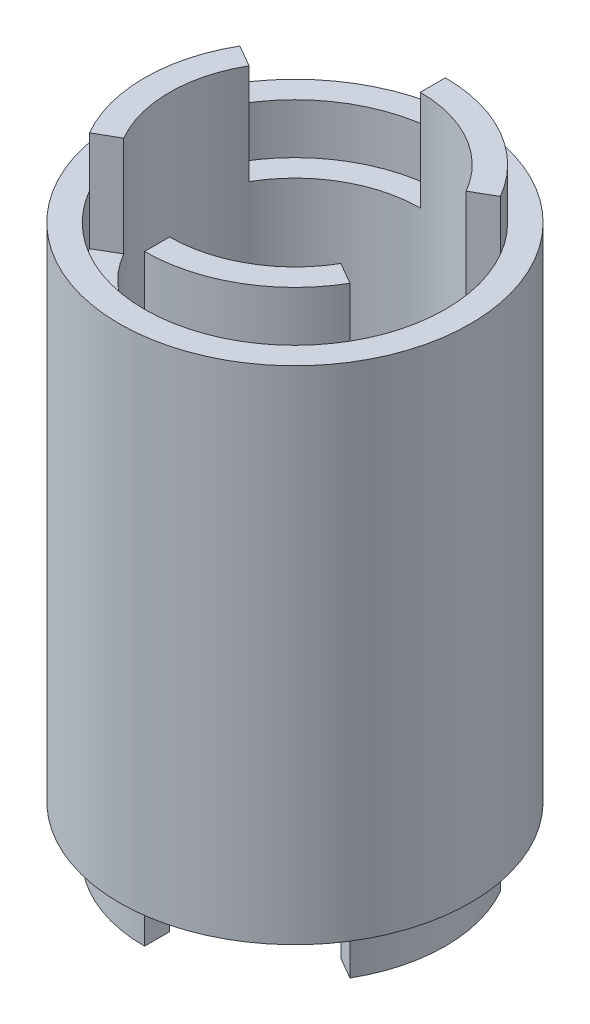
from build123d import *
from build123d.topology import SkipClean

# Parameters (mm, degrees)
SKETCH1_R           = 15
SKETCH1_R_2         = 12.5
BOSS_EXTRUDE1_DEPTH = 17.5
SKETCH2_R           = 17.5
SKETCH2_R_2         = 15
BOSS_EXTRUDE2_DEPTH = 25
BOSS_EXTRUDE3_START = 12.5
SKETCH3_R           = 15
SKETCH3_R_2         = 12.5
BOSS_EXTRUDE3_DEPTH = 12.5
BOSS_EXTRUDE4_DEPTH = 12.5
BOSS_EXTRUDE6_DEPTH = 2.5
CUT_EXTRUDE1_DEPTH  = 10


with BuildPart() as part:
    # Sketch1 → Boss-Extrude1 (new, symmetric)
    with BuildSketch(Plane(origin=(0, 0, 0), x_dir=(1, 0, 0), z_dir=(0, 1, 0))):
        Circle(SKETCH1_R)
        Circle(SKETCH1_R_2, mode=Mode.SUBTRACT)
    extrude(amount=BOSS_EXTRUDE1_DEPTH, both=True)

    # Sketch2 → Boss-Extrude2 (add, symmetric)
    with BuildSketch(Plane(origin=(0, 0, 0), x_dir=(1, 0, 0), z_dir=(0, 1, 0))):
        Circle(SKETCH2_R)
        Circle(SKETCH2_R_2, mode=Mode.SUBTRACT)
    extrude(amount=BOSS_EXTRUDE2_DEPTH, both=True)

    # Sketch3 → Boss-Extrude3 (add)
    with BuildSketch(Plane.XZ.offset(17.5).offset(BOSS_EXTRUDE3_START)):
        Circle(SKETCH3_R)
        Circle(SKETCH3_R_2, mode=Mode.SUBTRACT)
    extrude(amount=-BOSS_EXTRUDE3_DEPTH)

    # Sketch4 → Boss-Extrude4 (add)
    with SkipClean():  # the faces are left unmerged after this step: merging them gives an invalid solid
        with BuildSketch(Plane(origin=(0, 17.5, 0), x_dir=(1, 0, 0), z_dir=(0, 1, 0))):
            with BuildLine():
                Line((0, 12.5), (0, 15))
                ThreePointArc((0, 15), (7.5, 12.990381057), (12.990381057, 7.5))
                Line((12.990381057, 7.5), (10.825317547, 6.25))
                ThreePointArc((10.825317547, 6.25), (6.25, 10.825317547), (0, 12.5))
            make_face()
            with BuildLine():
                Line((10.825317547, -6.25), (12.990381057, -7.5))
                ThreePointArc((12.990381057, -7.5), (7.5, -12.990381057), (0, -15))
                Line((0, -15), (0, -12.5))
                ThreePointArc((0, -12.5), (6.25, -10.825317547), (10.825317547, -6.25))
            make_face()
            with BuildLine():
                Line((-10.825317547, -6.25), (-12.990381057, -7.5))
                ThreePointArc((-12.990381057, -7.5), (-15, 0), (-12.990381057, 7.5))
                Line((-12.990381057, 7.5), (-10.825317547, 6.25))
                ThreePointArc((-10.825317547, 6.25), (-12.5, 0), (-10.825317547, -6.25))
            make_face()
        extrude(amount=BOSS_EXTRUDE4_DEPTH)

    # Sketch6 → Boss-Extrude6 (add)
    with SkipClean():  # the faces are left unmerged after this step: merging them gives an invalid solid
        with BuildSketch(Plane(origin=(0, 17.5, 0), x_dir=(1, 0, 0), z_dir=(0, 1, 0))):
            with BuildLine():
                Line((-12.990381057, 7.5), (-10.825317547, 6.25))
                ThreePointArc((-10.825317547, 6.25), (-6.25, 10.825317547), (0, 12.5))
                Line((0, 12.5), (0, 15))
                ThreePointArc((0, 15), (-7.5, 12.990381057), (-12.990381057, 7.5))
            make_face()
            with BuildLine():
                Line((0, -15), (0, -12.5))
                ThreePointArc((0, -12.5), (-6.25, -10.825317547), (-10.825317547, -6.25))
                Line((-10.825317547, -6.25), (-12.990381057, -7.5))
                ThreePointArc((-12.990381057, -7.5), (-7.5, -12.990381057), (0, -15))
            make_face()
            with BuildLine():
                Line((10.825317547, -6.25), (12.990381057, -7.5))
                ThreePointArc((12.990381057, -7.5), (15, 0), (12.990381057, 7.5))
                Line((12.990381057, 7.5), (10.825317547, 6.25))
                ThreePointArc((10.825317547, 6.25), (12.5, 0), (10.825317547, -6.25))
            make_face()
        extrude(amount=BOSS_EXTRUDE6_DEPTH)

    # Sketch7 → Cut-Extrude1 (cut)
    with SkipClean():  # the faces are left unmerged after this step: merging them gives an invalid solid
        with BuildSketch(Plane.XZ.offset(30)):
            with BuildLine():
                Line((0, 12.5), (0, 15))
                ThreePointArc((0, 15), (7.5, 12.990381057), (12.990381057, 7.5))
                Line((12.990381057, 7.5), (10.825317547, 6.25))
                ThreePointArc((10.825317547, 6.25), (6.25, 10.825317547), (0, 12.5))
            make_face()
            with BuildLine():
                Line((10.825317547, -6.25), (12.990381057, -7.5))
                ThreePointArc((12.990381057, -7.5), (7.5, -12.990381057), (0, -15))
                Line((0, -15), (0, -12.5))
                ThreePointArc((0, -12.5), (6.25, -10.825317547), (10.825317547, -6.25))
            make_face()
            with BuildLine():
                Line((-10.825317547, -6.25), (-12.990381057, -7.5))
                ThreePointArc((-12.990381057, -7.5), (-15, 0), (-12.990381057, 7.5))
                Line((-12.990381057, 7.5), (-10.825317547, 6.25))
                ThreePointArc((-10.825317547, 6.25), (-12.5, 0), (-10.825317547, -6.25))
            make_face()
        extrude(amount=-CUT_EXTRUDE1_DEPTH, mode=Mode.SUBTRACT)


solid = part.part
